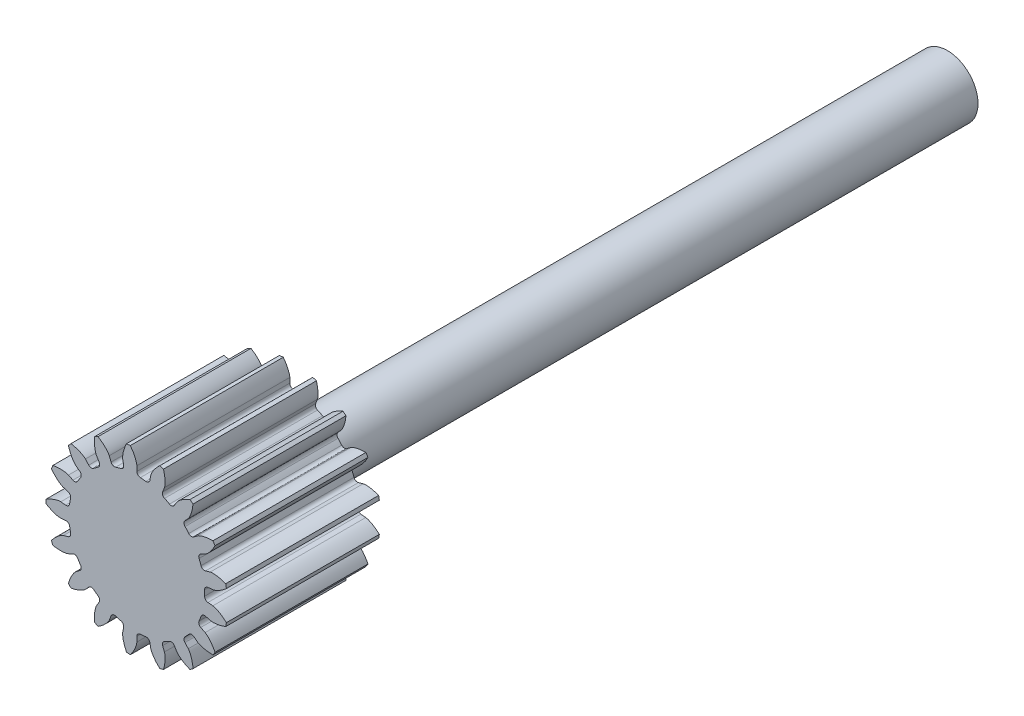
from build123d import *

# Parameters (mm, degrees)
BLANK_SKETCH_R      = 11.875
BLANK_DEPTH         = 20
TOOTH_SPACE_DEPTH   = 27.11572802
TEETH_COUNT         = 17
BORE_DEPTH          = 27.102125703
BORE_DEPTH_BACK     = 27.102125703
BORE_SKETCH_R       = 4
BOSS_EXTRUDE1_START = -106
SKETCH1_R           = 4
BOSS_EXTRUDE1_DEPTH = 106


with BuildPart() as part:
    # Blank Sketch → Blank (new body)
    with BuildSketch(Plane.XY):
        Circle(BLANK_SKETCH_R)
    extrude(amount=BLANK_DEPTH)

    # Tooth Space Sketch → Tooth Space (cut, symmetric)
    with BuildSketch(Plane.XY):
        with BuildLine():
            Line((9.942364801, 0.91340716), (9.298767719, 0.854279759))
            ThreePointArc((9.298767719, 0.854279759), (8.984863997, 0.694192597), (8.867618155, 0.361902274))
            ThreePointArc((8.867618155, 0.361902274), (8.875, 0), (8.867618155, -0.361902274))
            ThreePointArc((8.867618155, -0.361902274), (8.984863997, -0.694192597), (9.298767719, -0.854279759))
            Line((9.298767719, -0.854279759), (9.942364801, -0.91340716))
            add(Edge.make_bspline(
                [(9.942364801, -0.91340716), (9.947707774, -0.913995463), (9.962658326, -0.915943937), (9.990773403, -0.92080477), (10.03637124, -0.930398576), (10.094010888, -0.945054989), (10.167889919, -0.966771469), (10.254035794, -0.995895766), (10.347670082, -1.031581288), (10.448308522, -1.074335805), (10.547535018, -1.120434221), (10.645345427, -1.169591339), (10.74167088, -1.221399901), (10.856958299, -1.28747082), (10.993207383, -1.371281114), (11.149344102, -1.475798759), (11.322581132, -1.601986981), (11.494732709, -1.73857283), (11.660412139, -1.879471881), (11.823262512, -2.029086969), (11.977584919, -2.17897923), (12.132897457, -2.341825663), (12.273746711, -2.495808162), (12.42574568, -2.675962445), (12.546739308, -2.823606943), (12.666700658, -2.982295404), (12.724336253, -3.060430467), (12.753472124, -3.10073762)],
                knots=[0, 0, 0, 0, 0, 0.005376748, 0.015083688, 0.02853182, 0.046610139, 0.064854849, 0.092110525, 0.119476176, 0.146842495, 0.174208854, 0.201574955, 0.228941013, 0.256307345, 0.307035032, 0.361767351, 0.41649966, 0.471231936, 0.525964282, 0.580696615, 0.635428982, 0.690161387, 0.744893688, 0.799626082, 0.854358408, 0.909090915, 0.909090915, 0.909090915, 0.909090915, 0.909090915], degree=4))
            Line((12.753472124, -3.10073762), (12.753472124, 3.10073762))
            add(Edge.make_bspline(
                [(9.942364801, 0.91340716), (9.947707774, 0.913995463), (9.962658326, 0.915943937), (9.990773403, 0.92080477), (10.03637124, 0.930398576), (10.094010888, 0.945054989), (10.167889919, 0.966771469), (10.254035794, 0.995895766), (10.347670082, 1.031581288), (10.448308522, 1.074335805), (10.547535018, 1.120434221), (10.645345427, 1.169591339), (10.74167088, 1.221399901), (10.856958299, 1.28747082), (10.993207383, 1.371281114), (11.149344102, 1.475798759), (11.322581132, 1.601986981), (11.494732709, 1.73857283), (11.660412139, 1.879471881), (11.823262512, 2.029086969), (11.977584919, 2.17897923), (12.132897457, 2.341825663), (12.273746711, 2.495808162), (12.42574568, 2.675962445), (12.546739308, 2.823606943), (12.666700658, 2.982295404), (12.724336253, 3.060430467), (12.753472124, 3.10073762)],
                knots=[0, 0, 0, 0, 0, 0.005376748, 0.015083688, 0.02853182, 0.046610139, 0.064854849, 0.092110525, 0.119476176, 0.146842495, 0.174208854, 0.201574955, 0.228941013, 0.256307345, 0.307035032, 0.361767351, 0.41649966, 0.471231936, 0.525964282, 0.580696615, 0.635428982, 0.690161387, 0.744893688, 0.799626082, 0.854358408, 0.909090915, 0.909090915, 0.909090915, 0.909090915, 0.909090915], degree=4))
        make_face()
    tooth_space = extrude(amount=TOOTH_SPACE_DEPTH, both=True, mode=Mode.SUBTRACT)

    # Teeth: Tooth Space ×17 about axis
    teeth_axis = Axis((0, 0, -91.300007), (0, 0, 1))
    for i in range(1, TEETH_COUNT):
        add(tooth_space.rotate(teeth_axis, i * 360 / TEETH_COUNT), mode=Mode.SUBTRACT)

    # Bore Sketch → Bore (cut, two sides: drawn at the far end of the back side and taken through both)
    with BuildSketch(Plane.XY.offset(-BORE_DEPTH_BACK)):
        Circle(BORE_SKETCH_R)
    extrude(amount=BORE_DEPTH + BORE_DEPTH_BACK, mode=Mode.SUBTRACT)

    # Sketch1 → Boss-Extrude1 (add)
    with BuildSketch(Plane.XY.offset(20).offset(BOSS_EXTRUDE1_START)):
        Circle(SKETCH1_R)
    extrude(amount=BOSS_EXTRUDE1_DEPTH)


solid = part.part
